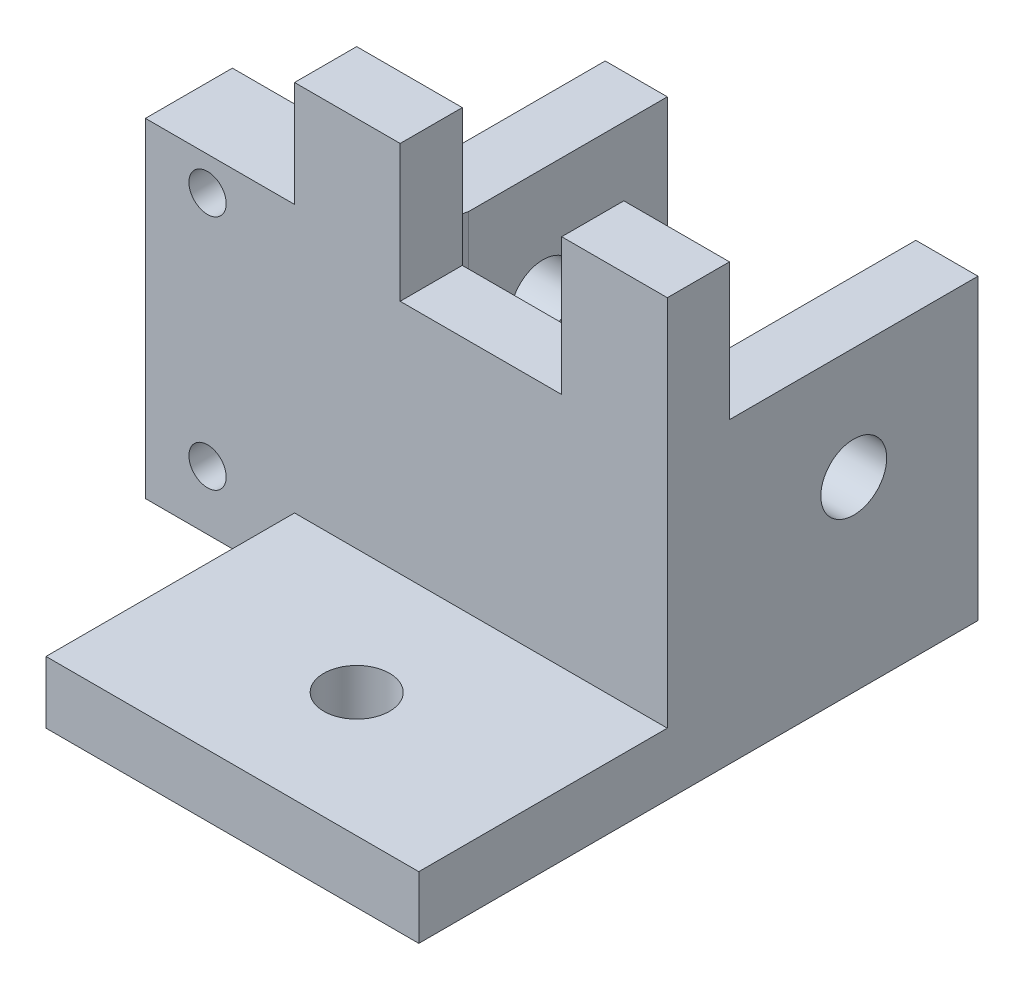
from build123d import *

# Parameters (mm, degrees)
SKETCH1_W               = 30
SKETCH1_H               = 45
BOSS_EXTRUDE1_DEPTH     = 5
SKETCH2_W               = 30
SKETCH2_H               = 5
BOSS_EXTRUDE2_DEPTH     = 30
SKETCH3_W               = 5
SKETCH3_H               = 20
BOSS_EXTRUDE3_DEPTH     = 19
SKETCH4_W               = 13
SKETCH4_H               = 5
CUT_EXTRUDE1_DEPTH      = 11
SKETCH5_R               = 2.65
CUT_EXTRUDE2_DEPTH      = 10
CUT_EXTRUDE3_DEPTH      = 65.420493634
CUT_EXTRUDE3_DEPTH_BACK = 65.420493634
SKETCH6_R               = 2.65
CUT_EXTRUDE4_DEPTH      = 20
CUT_EXTRUDE5_REACH      = 61.169
SKETCH9_W               = 5
SKETCH9_H               = 26.5
BOSS_EXTRUDE4_DEPTH     = 12
SKETCH10_W              = 12
SKETCH10_H              = 9
SKETCH10_H_2            = 7
BOSS_EXTRUDE5_DEPTH     = 2
CHAMFER1_SIZE           = 2
CHAMFER2_SIZE           = 2
SKETCH11_R              = 1.5
CUT_EXTRUDE6_DEPTH      = 54.422841557


with BuildPart() as part:
    # Sketch1 → Boss-Extrude1 (new body)
    with BuildSketch(Plane(origin=(0, 0, 0), x_dir=(1, 0, 0), z_dir=(0, 1, 0))):
        with Locations((15, 22.5)):
            Rectangle(SKETCH1_W, SKETCH1_H)
    extrude(amount=BOSS_EXTRUDE1_DEPTH)

    # Sketch2 → Boss-Extrude2 (add)
    with BuildSketch(Plane(origin=(0, 5, 0), x_dir=(1, 0, 0), z_dir=(0, 1, 0))):
        with Locations((15, 22.5)):
            Rectangle(SKETCH2_W, SKETCH2_H)
    extrude(amount=BOSS_EXTRUDE2_DEPTH)

    # Sketch3 → Boss-Extrude3 (add)
    with BuildSketch(Plane(origin=(0, 5, 0), x_dir=(1, 0, 0), z_dir=(0, 1, 0))):
        with Locations((2.5, 35)):
            Rectangle(SKETCH3_W, SKETCH3_H)
        with Locations((27.5, 35)):
            Rectangle(SKETCH3_W, SKETCH3_H)
    extrude(amount=BOSS_EXTRUDE3_DEPTH)

    # Sketch4 → Cut-Extrude1 (cut)
    with BuildSketch(Plane(origin=(0, 35, 0), x_dir=(1, 0, 0), z_dir=(0, 1, 0))):
        with Locations((15, 22.5)):
            Rectangle(SKETCH4_W, SKETCH4_H)
    extrude(amount=-CUT_EXTRUDE1_DEPTH, mode=Mode.SUBTRACT)

    # Sketch5 → Cut-Extrude2 (cut)
    with BuildSketch(Plane.XZ):
        with Locations(Location((15, -10, 0), (0, 0, 270))):
            Circle(SKETCH5_R)
        with Locations(Location((15, -35, 0), (0, 0, 270))):
            Circle(SKETCH5_R)
    extrude(amount=-CUT_EXTRUDE2_DEPTH, mode=Mode.SUBTRACT)

    # Sketch6 → Cut-Extrude3 (cut, two sides: drawn at the far end of the back side and taken through both)
    with BuildSketch(Plane(origin=(30, 0, 0), x_dir=(0, 0, -1), z_dir=(1, 0, 0)).offset(-CUT_EXTRUDE3_DEPTH_BACK)):
        with Locations((35, 15)):
            Circle(SKETCH6_R)
    extrude(amount=CUT_EXTRUDE3_DEPTH + CUT_EXTRUDE3_DEPTH_BACK, mode=Mode.SUBTRACT)

    # Sketch7 → Cut-Extrude4 (cut)
    with BuildSketch(Plane(origin=(0, 0, -45), x_dir=(-1, 0, 0), z_dir=(0, 0, -1))):
        Polygon((-25, 5), (-26, 5), (-25, 9), align=None)
        Polygon((-5, 5), (-4, 5), (-5, 9), align=None)
    extrude(amount=-CUT_EXTRUDE4_DEPTH, mode=Mode.SUBTRACT)

    # Cut-Extrude5: up to this face of the body (flat: up to its plane)
    cut_extrude5_end = Plane(part.part.faces().sort_by_distance((0.360555128, 5, -10))[0])
    # Sketch8 → Cut-Extrude5 (cut, up to the picked face)
    with BuildSketch(Plane(origin=(0, 24, 0), x_dir=(1, 0, 0), z_dir=(0, 1, 0)), mode=Mode.PRIVATE) as cut_extrude5_sk1:
        Polygon((25, 25), (26, 25), (25, 29), align=None)
    cut_extrude5_tool1 = split(extrude(cut_extrude5_sk1.sketch, amount=-CUT_EXTRUDE5_REACH, mode=Mode.PRIVATE), bisect_by=cut_extrude5_end, keep=Keep.BOTH, mode=Mode.PRIVATE)
    # Sketch8 → Cut-Extrude5 (cut, up to the picked face)
    with BuildSketch(Plane(origin=(0, 24, 0), x_dir=(1, 0, 0), z_dir=(0, 1, 0)), mode=Mode.PRIVATE) as cut_extrude5_sk2:
        Polygon((5, 25), (5, 29), (4, 25), align=None)
    cut_extrude5_tool2 = split(extrude(cut_extrude5_sk2.sketch, amount=-CUT_EXTRUDE5_REACH, mode=Mode.PRIVATE), bisect_by=cut_extrude5_end, keep=Keep.BOTH, mode=Mode.PRIVATE)
    add(cut_extrude5_tool1.solids().sort_by(Axis((25.333333, 24, -26.333333), (0, -1, 0)))[0], mode=Mode.SUBTRACT)
    add(cut_extrude5_tool2.solids().sort_by(Axis((4.666667, 24, -26.333333), (0, -1, 0)))[0], mode=Mode.SUBTRACT)

    # Sketch9 → Boss-Extrude4 (add)
    with BuildSketch(Plane.ZY):
        with Locations((-22.5, 13.25)):
            Rectangle(SKETCH9_W, SKETCH9_H)
    extrude(amount=BOSS_EXTRUDE4_DEPTH)

    # Sketch10 → Boss-Extrude5 (add)
    with BuildSketch(Plane(origin=(0, 0, -25), x_dir=(-1, 0, 0), z_dir=(0, 0, -1))):
        with Locations((6, 4.5)):
            Rectangle(SKETCH10_W, SKETCH10_H)
        with Locations((6, 23)):
            Rectangle(SKETCH10_W, SKETCH10_H_2)
    extrude(amount=BOSS_EXTRUDE5_DEPTH)

    # Chamfer1
    chamfer1_edges = [part.edges().sort_by_distance(p)[0] for p in [
        (-6, 19.5, -27),
    ]]
    chamfer(chamfer1_edges, length=CHAMFER1_SIZE - 0.0001)  # a hair under: the kernel refuses the full size

    # Chamfer2
    chamfer2_edges = [part.edges().sort_by_distance(p)[0] for p in [
        (-6, 9, -27),
    ]]
    chamfer(chamfer2_edges, length=CHAMFER2_SIZE - 0.0001)  # a hair under: the kernel refuses the full size

    # Sketch11 → Cut-Extrude6 (cut, through all)
    with BuildSketch(Plane(origin=(0, 0, -27), x_dir=(-1, 0, 0), z_dir=(0, 0, -1))):
        with Locations((7, 23.8)):
            Circle(SKETCH11_R)
        with Locations((7, 4.75)):
            Circle(SKETCH11_R)
    extrude(amount=-CUT_EXTRUDE6_DEPTH, mode=Mode.SUBTRACT)


solid = part.part
